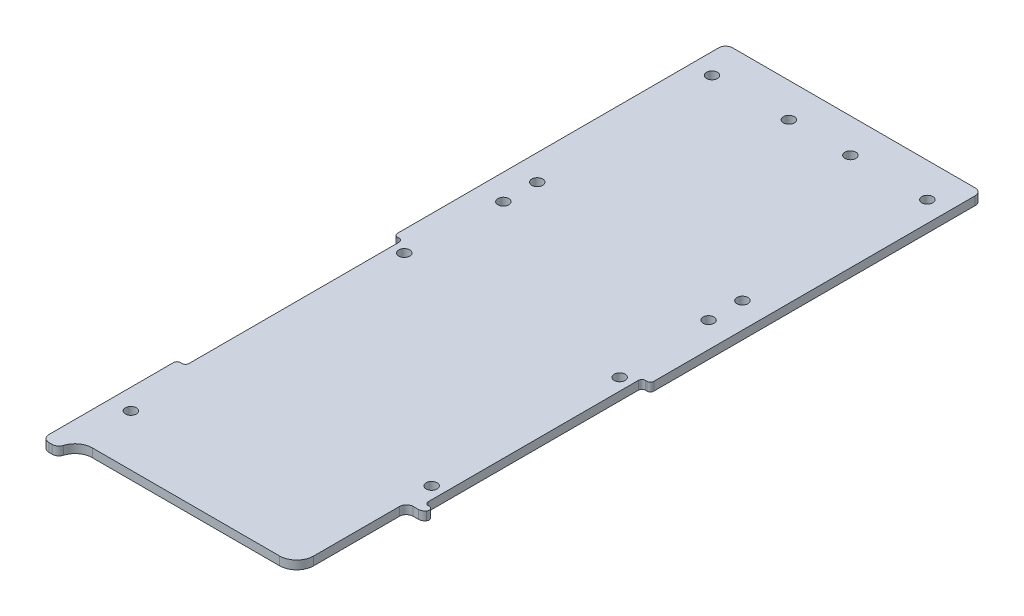
from build123d import *

# Parameters (mm, degrees)
SKETCH1_R               = 2.032
BOSS_EXTRUDE1_DEPTH     = 3.175
FILLET1_R               = 2.54
FILLET2_R               = 2.54
FILLET3_R               = 6.35
CUT_EXTRUDE1_DEPTH      = 136.673215063
FILLET4_R               = 6.35
FILLET5_R               = 2.54
SKETCH3_R               = 2.032
CUT_EXTRUDE2_DEPTH      = 136.673215063
CUT_EXTRUDE3_DEPTH      = 136.673215063
CUT_EXTRUDE3_DEPTH_BACK = 136.673215063
SKETCH4_W               = 3.175
SKETCH4_H               = 80.645
FILLET6_R               = 1.27


with BuildPart() as part:
    # Sketch1 → Boss-Extrude1 (new body)
    with BuildSketch(Plane(origin=(0, 0, 0), x_dir=(1, 0, 0), z_dir=(0, 1, 0))):
        Polygon((47.625, 127), (-47.625, 127), (-47.625, -127), (-41.275, -127), (-41.275, -120.65), (41.275, -120.65), (41.275, -127), (47.625, -127), align=None)
        with Locations((-39.999684148, -101.6)):
            Circle(SKETCH1_R, mode=Mode.SUBTRACT)
        with Locations((39.999684148, -69.85)):
            Circle(SKETCH1_R, mode=Mode.SUBTRACT)
        with Locations((-39.999684148, 0)):
            Circle(SKETCH1_R, mode=Mode.SUBTRACT)
        with Locations((-39.999684148, 114.3)):
            Circle(SKETCH1_R, mode=Mode.SUBTRACT)
        with Locations((-11.424684148, 114.3)):
            Circle(SKETCH1_R, mode=Mode.SUBTRACT)
        with Locations((39.999684148, 0)):
            Circle(SKETCH1_R, mode=Mode.SUBTRACT)
        with Locations((11.424684148, 114.3)):
            Circle(SKETCH1_R, mode=Mode.SUBTRACT)
        with Locations((39.999684148, 114.3)):
            Circle(SKETCH1_R, mode=Mode.SUBTRACT)
    extrude(amount=BOSS_EXTRUDE1_DEPTH)

    # Fillet1
    fillet1_edges = [part.edges().sort_by_distance(p)[0] for p in [
        (-47.625, 1.5875, -127),
        (47.625, 1.5875, -127),
        (47.625, 1.5875, 127),
        (-47.625, 1.5875, 127),
    ]]
    fillet(fillet1_edges, radius=FILLET1_R)

    # Fillet2
    fillet2_edges = [part.edges().sort_by_distance(p)[0] for p in [
        (41.275, 1.5875, 127),
        (-41.275, 1.5875, 127),
    ]]
    fillet(fillet2_edges, radius=FILLET2_R)

    # Fillet3
    fillet3_edges = [part.edges().sort_by_distance(p)[0] for p in [
        (41.275, 1.5875, 120.65),
        (-41.275, 1.5875, 120.65),
    ]]
    fillet(fillet3_edges, radius=FILLET3_R)

    # Sketch2 → Cut-Extrude1 (cut, through all)
    with BuildSketch(Plane.XZ):
        with BuildLine():
            Line((40.64508, 123.578690235), (40.64508, 79.88808))
            Line((40.64508, 79.88808), (47.625, 79.88808))
            Line((47.625, 79.88808), (47.625, 124.46))
            ThreePointArc((47.625, 124.46), (46.881051224, 126.256051224), (45.085, 127))
            Line((45.085, 127), (43.815, 127))
            ThreePointArc((43.815, 127), (42.297059666, 126.496530663), (41.380880287, 125.185714286))
            ThreePointArc((41.380880287, 125.185714286), (41.069166069, 124.356476684), (40.64508, 123.578690235))
        make_face()
    extrude(amount=-CUT_EXTRUDE1_DEPTH, mode=Mode.SUBTRACT)

    # Fillet4
    fillet4_edges = [part.edges().sort_by_distance(p)[0] for p in [
        (40.64508, 1.5875, 123.578690235),
    ]]
    fillet(fillet4_edges, radius=FILLET4_R)

    # Fillet5
    fillet5_edges = [part.edges().sort_by_distance(p)[0] for p in [
        (47.625, 1.5875, 79.88808),
        (40.64508, 1.5875, 79.88808),
    ]]
    fillet(fillet5_edges, radius=FILLET5_R)

    # Sketch3 → Cut-Extrude2 (cut, through all)
    with BuildSketch(Plane.XZ):
        with Locations((-38.109546207, -34.913768806)):
            Circle(SKETCH3_R)
        with Locations((-38.109546207, -47.490173279)):
            Circle(SKETCH3_R)
        with Locations((38.109546207, -47.490173279)):
            Circle(SKETCH3_R)
        with Locations((38.109546207, -34.913768806)):
            Circle(SKETCH3_R)
    extrude(amount=-CUT_EXTRUDE2_DEPTH, mode=Mode.SUBTRACT)

    # Sketch4 → Cut-Extrude3 (cut, two sides: drawn at the far end of the back side and taken through both)
    with BuildSketch(Plane(origin=(0, 3.175, 0), x_dir=(1, 0, 0), z_dir=(0, 1, 0)).offset(-CUT_EXTRUDE3_DEPTH_BACK)):
        with Locations((-46.0375, -36.5125)):
            Rectangle(SKETCH4_W, SKETCH4_H)
        with Locations((46.0375, -36.5125)):
            Rectangle(SKETCH4_W, SKETCH4_H)
    extrude(amount=CUT_EXTRUDE3_DEPTH + CUT_EXTRUDE3_DEPTH_BACK, mode=Mode.SUBTRACT)

    # Fillet6
    fillet6_edges = [part.edges().sort_by_distance(p)[0] for p in [
        (-44.45, 1.5875, -3.81),
        (-47.625, 1.5875, -3.81),
        (-47.625, 1.5875, 76.835),
        (-44.45, 1.5875, 76.835),
        (44.45, 1.5875, 76.835),
        (47.625, 1.5875, 76.835),
        (44.45, 1.5875, -3.81),
        (47.625, 1.5875, -3.81),
    ]]
    fillet(fillet6_edges, radius=FILLET6_R)


solid = part.part
